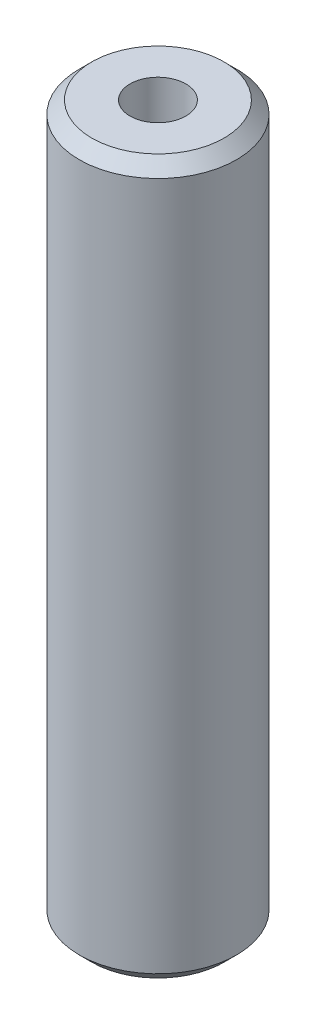
from build123d import *

# Parameters (mm, degrees)
SKETCH1_R           = 30
BOSS_EXTRUDE1_DEPTH = 272.418557323
SKETCH2_R           = 10.655685799
CUT_EXTRUDE1_DEPTH  = 276.702503387
CHAMFER1_SIZE       = 4.764431115


with BuildPart() as part:
    # Sketch1 → Boss-Extrude1 (new body)
    with BuildSketch(Plane(origin=(0, 0, 0), x_dir=(1, 0, 0), z_dir=(0, 1, 0))):
        Circle(SKETCH1_R)
    extrude(amount=BOSS_EXTRUDE1_DEPTH)

    # Sketch2 → Cut-Extrude1 (cut, through all)
    with BuildSketch(Plane(origin=(0, 0, 0), x_dir=(1, 0, 0), z_dir=(0, 1, 0))):
        Circle(SKETCH2_R)
    extrude(amount=CUT_EXTRUDE1_DEPTH, mode=Mode.SUBTRACT)

    # Chamfer1
    chamfer1_edges = [part.edges().sort_by_distance(p)[0] for p in [
        (-30, 272.418557323, 0),
        (-30, 0, 0),
    ]]
    chamfer(chamfer1_edges, length=CHAMFER1_SIZE)


solid = part.part
